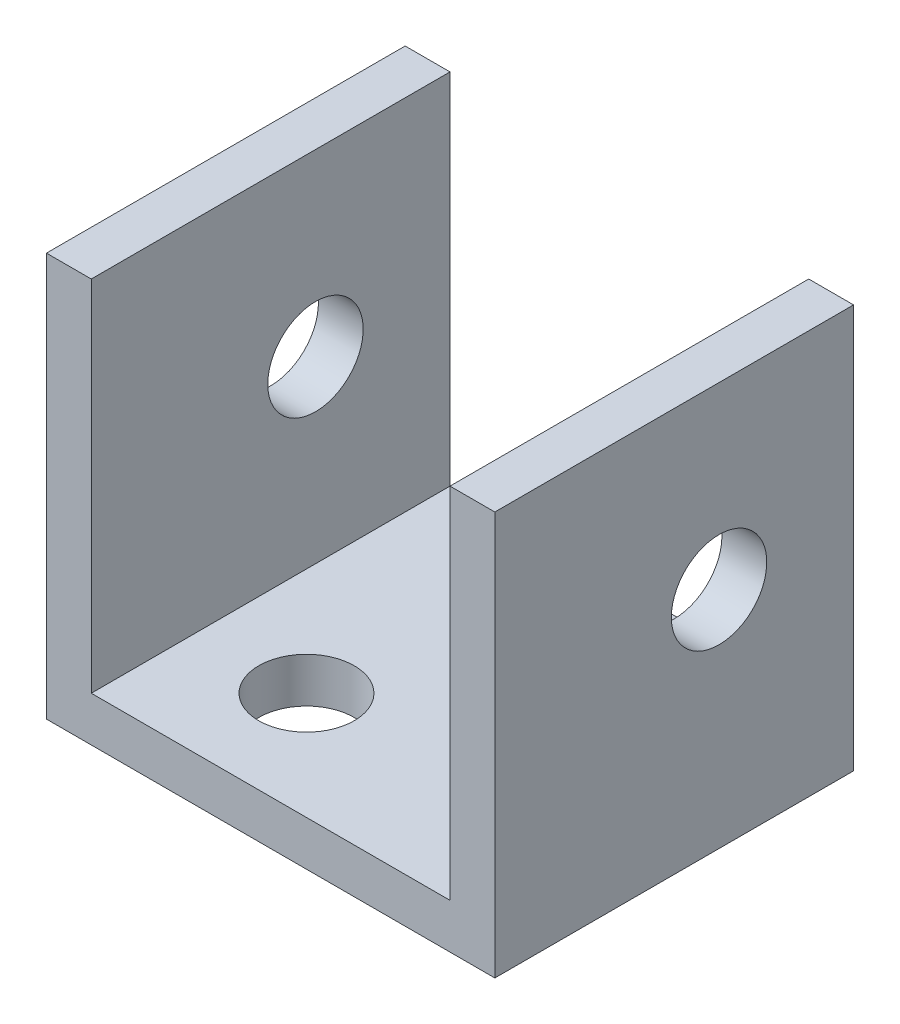
from build123d import *

# Parameters (mm, degrees)
SKETCH1_W               = 31.75
SKETCH1_H               = 25.4
BOSS_EXTRUDE1_DEPTH     = 3.175
SKETCH2_W               = 3.175
SKETCH2_H               = 25.4
BOSS_EXTRUDE2_DEPTH     = 25.4
F_1_4_CLEARANCE_HOLE2_D = 6.7564
F_1_4_CLEARANCE_HOLE1_D = 6.7564


with BuildPart() as part:
    # Sketch1 → Boss-Extrude1 (new body)
    with BuildSketch(Plane(origin=(0, 0, 0), x_dir=(1, 0, 0), z_dir=(0, 1, 0))):
        Rectangle(SKETCH1_W, SKETCH1_H)
    extrude(amount=BOSS_EXTRUDE1_DEPTH)

    # Sketch2 → Boss-Extrude2 (add)
    with BuildSketch(Plane(origin=(0, 3.175, 0), x_dir=(1, 0, 0), z_dir=(0, 1, 0))):
        with Locations((-14.2875, 0)):
            Rectangle(SKETCH2_W, SKETCH2_H)
        with Locations((14.2875, 0)):
            Rectangle(SKETCH2_W, SKETCH2_H)
    extrude(amount=BOSS_EXTRUDE2_DEPTH)

    # 1/4 Clearance Hole2 (through all)
    with Locations(Plane(origin=(0, 3.175, 0), x_dir=(1, 0, 0), z_dir=(0, 1, 0))):
        with Locations((5.08, 5.08), (-5.08, -5.08)):
            Hole(F_1_4_CLEARANCE_HOLE2_D / 2)

    # 1/4 Clearance Hole1 (through all)
    with Locations(Plane.ZY.offset(15.875)):
        with Locations((-3.175, 15.875)):
            Hole(F_1_4_CLEARANCE_HOLE1_D / 2)


solid = part.part
